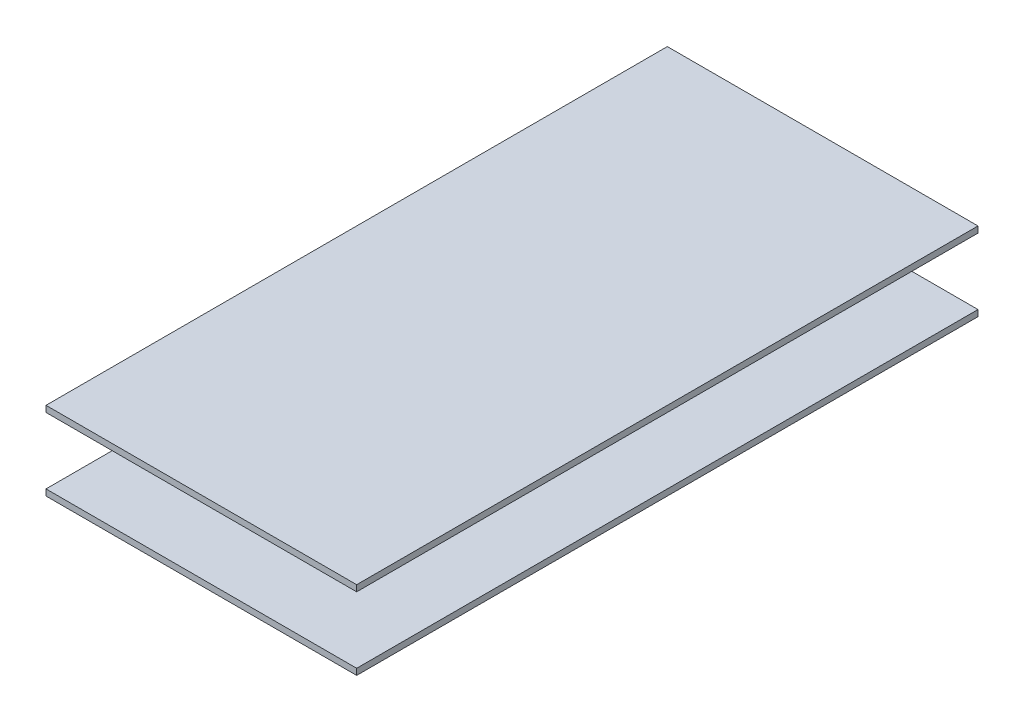
from build123d import *

# Parameters (mm, degrees)
SKETCH1_W           = 12.7
SKETCH1_H           = 12.7
BOSS_EXTRUDE1_DEPTH = 80
SKETCH2_R           = 2
CUT_EXTRUDE1_DEPTH  = 82.991341006
CUT_EXTRUDE2_DEPTH  = 82.991341006
BOSS_EXTRUDE2_START = 17
SKETCH5_R           = 2
BOSS_EXTRUDE2_DEPTH = 17
SKETCH6_R           = 2
BOSS_EXTRUDE3_DEPTH = 17
SKETCH7_W           = 100
SKETCH7_H           = 200
BOSS_EXTRUDE4_DEPTH = 2
SKETCH8_W           = 100
SKETCH8_H           = 200
BOSS_EXTRUDE5_DEPTH = 2


with BuildPart() as part:
    # Sketch1 → Boss-Extrude1 (new body)
    with BuildSketch(Plane.XY):
        with Locations((6.35, 6.35)):
            Rectangle(SKETCH1_W, SKETCH1_H)
    extrude(amount=BOSS_EXTRUDE1_DEPTH)

    # Sketch2 → Cut-Extrude1 (cut, through all)
    with BuildSketch(Plane(origin=(0, 12.7, 0), x_dir=(1, 0, 0), z_dir=(0, 1, 0))):
        with Locations((6.668720536, -5)):
            Circle(SKETCH2_R)
        with Locations((6.668720536, -20)):
            Circle(SKETCH2_R)
        with Locations((6.668720536, -60)):
            Circle(SKETCH2_R)
        with Locations((6.668720536, -75)):
            Circle(SKETCH2_R)
    extrude(amount=-CUT_EXTRUDE1_DEPTH, mode=Mode.SUBTRACT)

    # Sketch4 → Cut-Extrude2 (cut, through all)
    with BuildSketch(Plane.ZY):
        with BuildLine():
            ThreePointArc((40, 2.727500863), (49.05, 6.35), (40, 9.972499137))
            ThreePointArc((40, 9.972499137), (30.95, 6.35), (40, 2.727500863))
        make_face()
    extrude(amount=-CUT_EXTRUDE2_DEPTH, mode=Mode.SUBTRACT)

    # Sketch5 → Boss-Extrude2 (add)
    with BuildSketch(Plane(origin=(0, 0, 0), x_dir=(1, 0, 0), z_dir=(0, 1, 0)).offset(BOSS_EXTRUDE2_START)):
        with Locations((6.668720536, -20)):
            Circle(SKETCH5_R)
        with Locations((6.668720536, -5)):
            Circle(SKETCH5_R)
    extrude(amount=-BOSS_EXTRUDE2_DEPTH)

    # Sketch6 → Boss-Extrude3 (add)
    with BuildSketch(Plane(origin=(0, 12.7, 0), x_dir=(1, 0, 0), z_dir=(0, 1, 0))):
        with Locations((6.668720536, -75)):
            Circle(SKETCH6_R)
        with Locations((6.668720536, -60)):
            Circle(SKETCH6_R)
    extrude(amount=-BOSS_EXTRUDE3_DEPTH)

    # Sketch7 → Boss-Extrude4 (add)
    with BuildSketch(Plane(origin=(0, 17, 0), x_dir=(1, 0, 0), z_dir=(0, 1, 0))):
        with Locations((6.35, -40)):
            Rectangle(SKETCH7_W, SKETCH7_H)
    extrude(amount=BOSS_EXTRUDE4_DEPTH)

    # Sketch8 → Boss-Extrude5 (add)
    with BuildSketch(Plane.XZ.offset(4.3)):
        with Locations((6.35, 40)):
            Rectangle(SKETCH8_W, SKETCH8_H)
    extrude(amount=BOSS_EXTRUDE5_DEPTH)


solid = part.part
